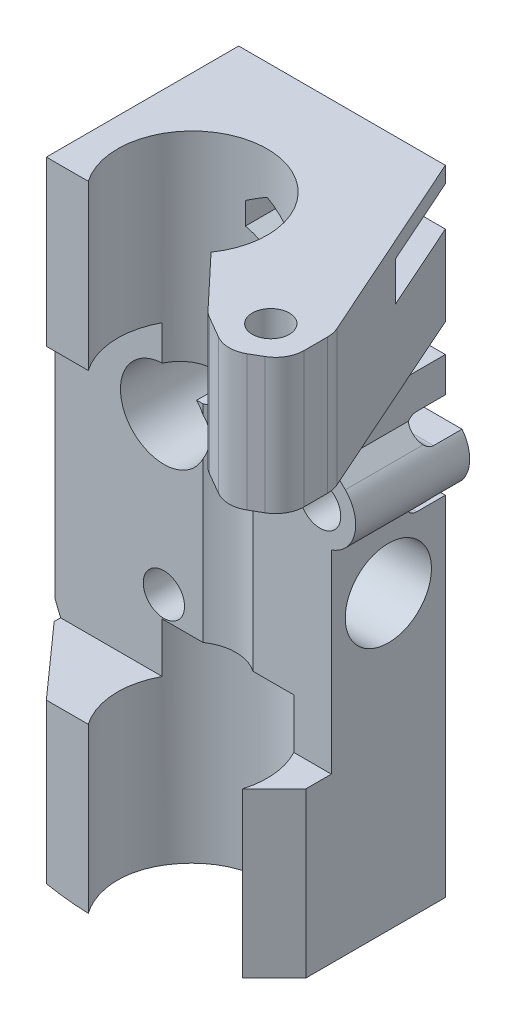
from build123d import *

# Parameters (mm, degrees)
SKETCH1_R                = 1.55
SKETCH1_R_2              = 6.1
BOSS_EXTRUDE1_DEPTH      = 27
CUT_EXTRUDE1_DEPTH       = 67.923113363
CUT_EXTRUDE1_DEPTH_BACK  = 15
SKETCH2_R                = 6.05
CUT_EXTRUDE4_DEPTH       = 67.923113363
CUT_EXTRUDE4_DEPTH_BACK  = 67.923113363
SKETCH3_R                = 6.1
CUT_EXTRUDE12_DEPTH      = 67.923113485
SKETCH4_W                = 63.995899026
SKETCH4_H                = 43
CUT_EXTRUDE6_DEPTH       = 11
SKETCH5_R                = 10.5
CUT_EXTRUDE7_DEPTH       = 30
CUT_EXTRUDE11_START      = -30
SKETCH6_R                = 10.5
CUT_EXTRUDE11_DEPTH      = 30
CUT_EXTRUDE13_DEPTH      = 67.923113526
CUT_EXTRUDE13_DEPTH_BACK = 67.923113526
CUT_EXTRUDE14_START      = 5.3
SKETCH9_R                = 2.9
CUT_EXTRUDE14_DEPTH      = 62.623113526
CUT_EXTRUDE16_START      = 5
CUT_EXTRUDE16_DEPTH      = 62.923113526
CUT_EXTRUDE20_DEPTH      = 6
CUT_EXTRUDE21_DEPTH      = 23
SKETCH17_R               = 2.6
BOSS_EXTRUDE2_DEPTH      = 19
CUT_EXTRUDE22_DEPTH      = 4
FILLET1_R                = 4
CUT_EXTRUDE23_DEPTH      = 4
CHAMFER2_SIZE            = 4.8
CHAMFER2_SIZE2           = 9.481813932


with BuildPart() as part:
    # Sketch1 → Boss-Extrude1 (new body)
    with BuildSketch(Plane.XY):
        with BuildLine():
            Line((-5.5, 34), (-26, 3.5))
            Line((-26, 3.5), (-26, -3.5))
            Line((-26, -3.5), (-5.5, -54.320530586))
            ThreePointArc((-5.5, -54.320530586), (-2.016449868, -54.829734397), (1.5, -55))
            Line((1.5, -55), (23.5, -55))
            Line((23.5, -55), (23.5, -35))
            Line((23.5, -35), (23.5, -4.74389926))
            ThreePointArc((23.5, -4.74389926), (26.786379651, -1.149507836), (25.455844123, 3.535533906))
            Line((25.455844123, 3.535533906), (23.5, 5.491378029))
            Line((23.5, 5.491378029), (23.5, 34))
            Line((23.5, 34), (-5.5, 34))
        make_face()
        with Locations((21.920310217, 0)):
            Circle(SKETCH1_R, mode=Mode.SUBTRACT)
        with Locations((0, -21.920310217)):
            Circle(SKETCH1_R, mode=Mode.SUBTRACT)
        with Locations((-21.920310217, 0)):
            Circle(SKETCH1_R, mode=Mode.SUBTRACT)
        with Locations((9, 25)):
            Circle(SKETCH1_R, mode=Mode.SUBTRACT)
        Circle(SKETCH1_R_2, mode=Mode.SUBTRACT)
        with Locations((9, -47)):
            Circle(SKETCH1_R, mode=Mode.SUBTRACT)
    extrude(amount=BOSS_EXTRUDE1_DEPTH)

    # Sketch2 → Cut-Extrude1 (cut, two sides: drawn at the far end of the back side and taken through both)
    with BuildSketch(Plane(origin=(0, 0, 0), x_dir=(0, 0, -1), z_dir=(1, 0, 0)).offset(-CUT_EXTRUDE1_DEPTH_BACK)):
        with Locations((-8, -14)):
            Circle(SKETCH2_R)
    extrude(amount=CUT_EXTRUDE1_DEPTH + CUT_EXTRUDE1_DEPTH_BACK, mode=Mode.SUBTRACT)

    # Sketch3 → Cut-Extrude4 (cut, two sides: drawn at the far end of the back side and taken through both)
    with BuildSketch(Plane(origin=(0, 0, 0), x_dir=(1, 0, 0), z_dir=(0, 1, 0)).offset(-CUT_EXTRUDE4_DEPTH_BACK)):
        with Locations((9, -21)):
            Circle(SKETCH3_R)
    extrude(amount=CUT_EXTRUDE4_DEPTH + CUT_EXTRUDE4_DEPTH_BACK, mode=Mode.SUBTRACT)

    # Sketch7 → Cut-Extrude12 (cut, through all)
    with BuildSketch(Plane(origin=(0, 0, 0), x_dir=(0, 0, -1), z_dir=(1, 0, 0))):
        with BuildLine():
            Line((-4, 6.1), (0, 6.1))
            ThreePointArc((0, 6.1), (1.5, 4.6), (0, 3.1))
            Line((0, 3.1), (-4, 3.1))
            ThreePointArc((-4, 3.1), (-5.5, 4.6), (-4, 6.1))
        make_face()
        with BuildLine():
            Line((-4, -6.1), (0, -6.1))
            ThreePointArc((0, -6.1), (1.5, -4.6), (0, -3.1))
            Line((0, -3.1), (-4, -3.1))
            ThreePointArc((-4, -3.1), (-5.5, -4.6), (-4, -6.1))
        make_face()
    extrude(amount=CUT_EXTRUDE12_DEPTH, mode=Mode.SUBTRACT)

    # Sketch4 → Cut-Extrude6 (cut)
    with BuildSketch(Plane.XY.offset(27)):
        with Locations((-0.149514417, -10.5)):
            Rectangle(SKETCH4_W, SKETCH4_H)
    extrude(amount=-CUT_EXTRUDE6_DEPTH, mode=Mode.SUBTRACT)

    # Sketch5 → Cut-Extrude7 (cut)
    with BuildSketch(Plane.XZ.offset(55)):
        with Locations((9, 21)):
            Circle(SKETCH5_R)
    extrude(amount=-CUT_EXTRUDE7_DEPTH, mode=Mode.SUBTRACT)

    # Sketch6 → Cut-Extrude11 (cut)
    with BuildSketch(Plane(origin=(0, 34, 0), x_dir=(1, 0, 0), z_dir=(0, 1, 0)).offset(CUT_EXTRUDE11_START)):
        with Locations((9, -21)):
            Circle(SKETCH6_R)
    extrude(amount=CUT_EXTRUDE11_DEPTH, mode=Mode.SUBTRACT)

    # Sketch8 → Cut-Extrude13 (cut, two sides: drawn at the far end of the back side and taken through both)
    with BuildSketch(Plane(origin=(0, 0, 0), x_dir=(1, 0, 0), z_dir=(0, 1, 0)).offset(-CUT_EXTRUDE13_DEPTH_BACK)):
        Polygon((-5.5, -27), (-26, -4), (-26, -27), align=None)
    extrude(amount=CUT_EXTRUDE13_DEPTH + CUT_EXTRUDE13_DEPTH_BACK, mode=Mode.SUBTRACT)

    # Sketch9 → Cut-Extrude14 (cut, through all)
    with BuildSketch(Plane.XY.offset(CUT_EXTRUDE14_START)):
        with Locations(Location((-21.920310217, 0, 0), (0, 0, 180))):
            Circle(SKETCH9_R)
        with Locations((21.920310217, 0)):
            Circle(SKETCH9_R)
        with Locations(Location((0, -21.920310217, 0), (0, 0, 120.207409423))):
            Circle(SKETCH9_R)
    extrude(amount=CUT_EXTRUDE14_DEPTH, mode=Mode.SUBTRACT)

    # Sketch11 → Cut-Extrude16 (cut, through all)
    with BuildSketch(Plane.XY.offset(CUT_EXTRUDE16_START)):
        Polygon((11.7, 23.441154273), (11.7, 26.558845727), (9, 28.117691454), (6.3, 26.558845727), (6.3, 23.441154273), (9, 21.882308546), align=None)
        Polygon((9, -50.117691454), (11.7, -48.558845727), (11.7, -45.441154273), (9, -43.882308546), (6.3, -45.441154273), (6.3, -48.558845727), align=None)
    extrude(amount=CUT_EXTRUDE16_DEPTH, mode=Mode.SUBTRACT)

    # Sketch15 → Cut-Extrude20 (cut)
    with BuildSketch(Plane(origin=(23.5, 0, 0), x_dir=(0, 0, -1), z_dir=(1, 0, 0))):
        Polygon((0, 11), (-8, 11), (-8, 15), (0, 15), (0, 14.529529041), align=None)
    extrude(amount=-CUT_EXTRUDE20_DEPTH, mode=Mode.SUBTRACT)

    # Chamfer1
    # the kernel refuses this chamfer: 8 mm, written as the material it adds along each edge
    with BuildSketch(Plane(origin=(17.5, 11, 8), x_dir=(0.9996219169112968, 0, 0.02749587661058627), z_dir=(0, 1, 0))) as chamfer1_piece_1_section:
        with BuildLine():
            Line((8.229385561, 0), (-0.452377239, 8.216942348))
            Line((-0.452377239, 8.216942348), (-0.612316746, 8.212543008))
            ThreePointArc((-0.612316746, 8.212543008), (-0.273033816, 4.107182637), (-0.159939507, -0.00439934))
            Line((-0.159939507, -0.00439934), (0.00439934, -0.159939507))
            ThreePointArc((0.00439934, -0.159939507), (4.115981318, -0.046845197), (8.233784902, -0.159939507))
            Line((8.233784902, -0.159939507), (8.229385561, 0))
        make_face()
    chamfer1_piece_1 = extrude(amount=4, mode=Mode.PRIVATE)
    chamfer1_piece_1 = split(chamfer1_piece_1, bisect_by=Plane(origin=(23.5, 13, 5.194033096), z_dir=(-1, 0, 0)), keep=Keep.TOP, mode=Mode.PRIVATE)
    chamfer1_piece_1 = split(chamfer1_piece_1, bisect_by=Plane(origin=(19.804552552, 13, 0), z_dir=(0, 0, 1)), keep=Keep.TOP, mode=Mode.PRIVATE)
    add(chamfer1_piece_1)

    # Sketch16 → Cut-Extrude21 (cut)
    with BuildSketch(Plane.XZ.offset(55)):
        Polygon((19.062305899, 24), (23.5, 19.562305899), (23.5, 27), (17.61684397, 27), align=None)
    extrude(amount=-CUT_EXTRUDE21_DEPTH, mode=Mode.SUBTRACT)

    # Sketch17 → Boss-Extrude2 (add)
    with BuildSketch(Plane(origin=(0, 34, 0), x_dir=(1, 0, 0), z_dir=(0, 1, 0))):
        Polygon((23.5, 0), (36.1, -28.266838493), (36.1, -34.733161507), (30.5, -37.966323015), (24.9, -34.733161507), (17.61684397, -27), (23.5, -27), align=None)
        with Locations(Location((30.5, -31.5, 0), (0, 0, 180))):
            Circle(SKETCH17_R, mode=Mode.SUBTRACT)
    extrude(amount=-BOSS_EXTRUDE2_DEPTH)

    # Sketch18 → Cut-Extrude22 (cut)
    with BuildSketch(Plane.XZ.offset(-15)):
        Polygon((34.5, 29.190598923), (34.5, 33.809401077), (30.5, 36.118802154), (26.5, 33.809401077), (26.5, 29.190598923), (30.5, 26.881197846), align=None)
    extrude(amount=-CUT_EXTRUDE22_DEPTH, mode=Mode.SUBTRACT)

    # Fillet1
    fillet1_edges = [part.edges().sort_by_distance(p)[0] for p in [
        (24.9, 24.5, 34.733161507),
        (30.5, 24.5, 37.966323015),
        (36.1, 24.5, 34.733161507),
        (36.1, 24.5, 28.266838493),
    ]]
    fillet(fillet1_edges, radius=FILLET1_R)

    # Sketch19 → Cut-Extrude23 (cut)
    with BuildSketch(Plane(origin=(0, 0, 0), x_dir=(-1, 0, 0), z_dir=(0, 0, -1))):
        Polygon((-20.41228676, 31.75), (-28.525335147, 31.75), (-30.113048387, 29), (-28.525335147, 26.25), (-20.41228676, 26.25), (-18.824573519, 29), align=None)
    extrude(amount=-CUT_EXTRUDE23_DEPTH, mode=Mode.SUBTRACT)

    # Chamfer2
    chamfer2_edges = [part.edges().sort_by_distance(p)[0] for p in [
        (25.283008029, 29, 4),
    ]]
    chamfer2_side = [part.faces().sort_by_distance(p)[0] for p in [
        (22.43217671, 29, 4),
    ]]
    chamfer(chamfer2_edges, length=CHAMFER2_SIZE, length2=CHAMFER2_SIZE2, reference=chamfer2_side[0])


solid = part.part
